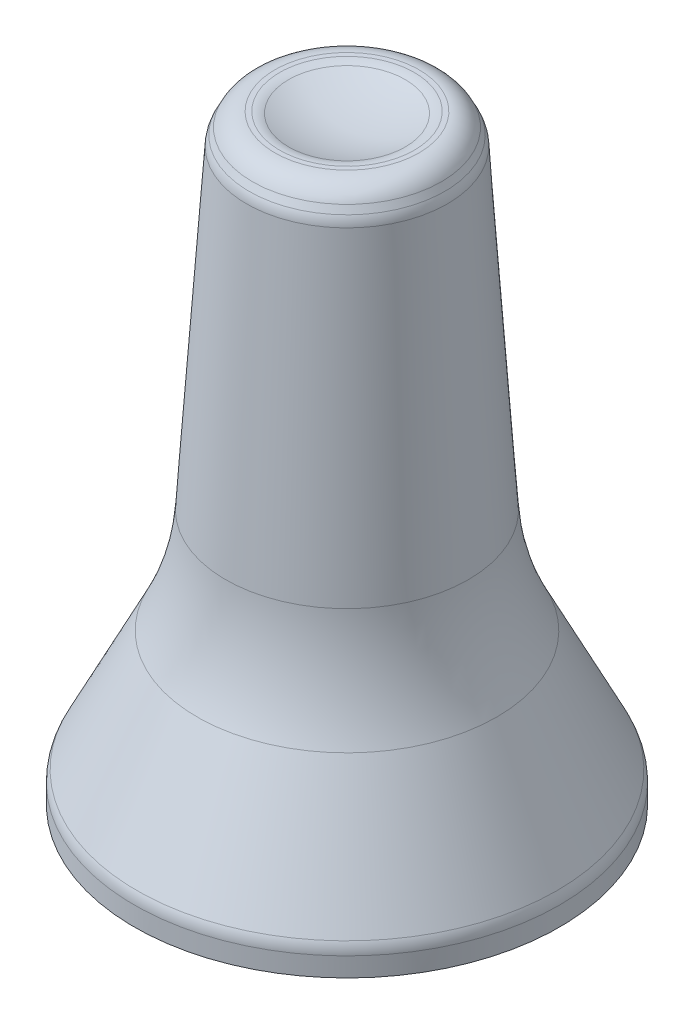
from build123d import *

# Parameters (mm, degrees)
FILLET1_R           = 11
FILLET2_R           = 1
BOSS_EXTRUDE1_DEPTH = 10.425
CHAMFER1_SIZE       = 0.35


with BuildPart() as part:
    # Sketch1 → Revolve1 (revolve)
    with BuildSketch(Plane.XY, mode=Mode.PRIVATE) as revolve1_sk:
        with BuildLine():
            Line((0, 0), (8.5, 0))
            Line((8.5, 0), (8.5, 1))
            Line((8.5, 1), (5, 8))
            Line((5, 8), (4, 23))
            Line((4, 23), (3.5, 24))
            Line((3.5, 24), (2.5, 24))
            add(Edge.make_bspline(
                [(2.5, 24), (1.3, 23.5), (0, 23.5)],
                knots=[0, 0, 0, 1, 1, 1], degree=2))
            Line((0, 23.5), (0, 0))
        make_face()
    revolve(revolve1_sk.sketch.rotate(Axis((0, 23.5, 0), (0, -1, 0)), 180), axis=Axis((0, 23.5, 0), (0, -1, 0)))

    # Fillet1
    fillet1_edges = [part.edges().sort_by_distance(p)[0] for p in [
        (5, 8, 0),
    ]]
    fillet(fillet1_edges, radius=FILLET1_R)

    # Fillet2
    fillet2_edges = [part.edges().sort_by_distance(p)[0] for p in [
        (2.5, 24, 0),
        (3.5, 24, 0),
        (4, 23, 0),
        (8.5, 1, 0),
    ]]
    fillet(fillet2_edges, radius=FILLET2_R)

    # Sketch3 → Cut-Revolve1 (revolve, cut)
    with BuildSketch(Plane.XY):
        Polygon((0, 0), (3.875, 0), (3.875, 6.5), (3.05, 7.325), (3.05, 17.75), (0, 17.75), align=None)
    revolve(axis=Axis((0, 17.75, 0), (0, -1, 0)), mode=Mode.SUBTRACT)

    # Sketch4 → Boss-Extrude1 (add)
    with BuildSketch(Plane.XZ.offset(-17.75)):
        with BuildLine():
            Line((-2.655654345, 1.5), (2.655654345, 1.5))
            ThreePointArc((2.655654345, 1.5), (0, 3.05), (-2.655654345, 1.5))
        make_face()
        with BuildLine():
            ThreePointArc((-0.099986562, -3.048360656), (0, -3.05), (0.099986562, -3.048360656))
            ThreePointArc((0.099986562, -3.048360656), (0, -2.95), (-0.099986562, -3.048360656))
        make_face()
    extrude(amount=BOSS_EXTRUDE1_DEPTH)

    # Chamfer1
    # the kernel refuses this chamfer: 0.35 mm, written as the material it takes off along each edge
    with BuildSketch(Plane(origin=(-3.555743391, 7.325, 1.5), x_dir=(0, 0.9996219169112968, -0.027495876610586154), z_dir=(1, 0, 0))) as chamfer1_piece_1_section:
        Polygon((CHAMFER1_SIZE * 0.999621916911, CHAMFER1_SIZE * 0.0274958766106), (-CHAMFER1_SIZE * 0.0274958766106, CHAMFER1_SIZE * 0.999621916911), (0, 0), align=None)
    chamfer1_piece_1 = extrude(amount=7.111486782, mode=Mode.PRIVATE)
    chamfer1_piece_1 = chamfer1_piece_1 & Plane(origin=(0, 7.499624527, 0), x_dir=(1, 0, 0), z_dir=(0, 1, 0)) * Cylinder(3.05, 16, mode=Mode.PRIVATE)
    add(chamfer1_piece_1, mode=Mode.SUBTRACT)


solid = part.part
